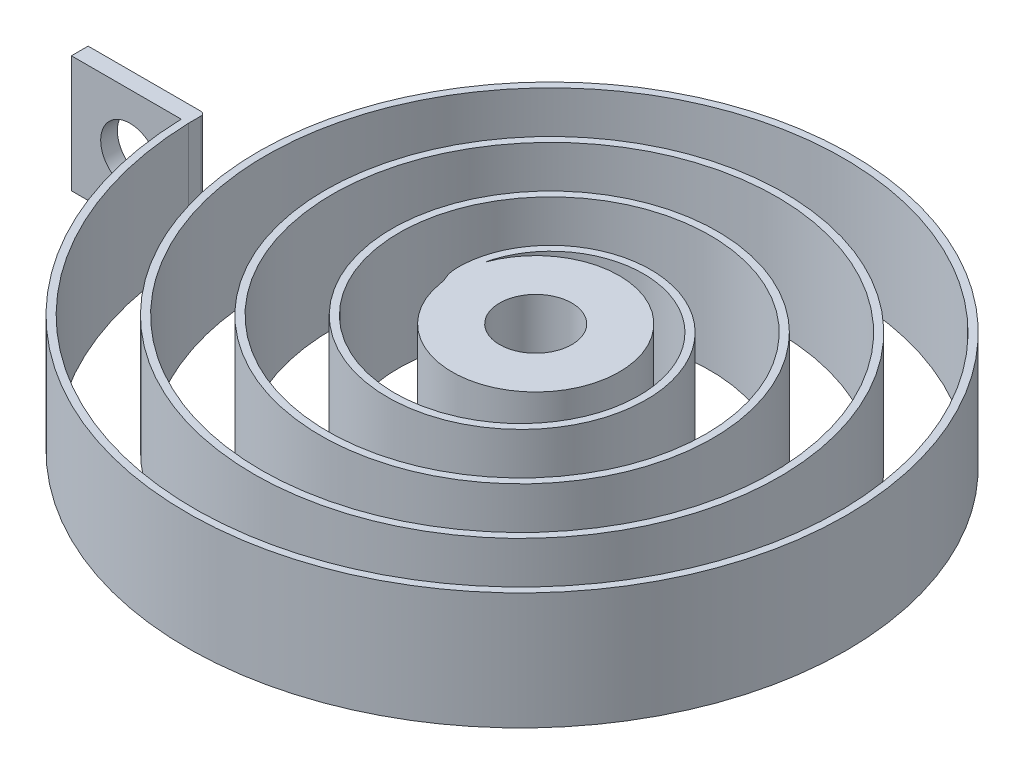
from build123d import *

# Parameters (mm, degrees)
SWEEP1_START                    = -3.5
SWEEP1_DEPTH                    = 7
BOSS_EXTRUDE1_REACH             = 31.519
SKETCH1_2_R                     = 5
BOSS_EXTRUDE1_DIRECTION_2_REACH = 31.519
FILLET3_START                   = -3.5
FILLET3_DEPTH                   = 7
FILLET4_R                       = 2
SKETCH4_R                       = 2.16
CUT_EXTRUDE1_DEPTH              = 10
SKETCH5_W                       = 7
SKETCH5_H                       = 7
SKETCH5_R                       = 1.75
BOSS_EXTRUDE2_DEPTH             = 1
FILLET5_R                       = 0.25


with BuildPart() as part:
    # Sweep1: read off the stored shape, not the designer's step
    # Sweep1 outline → Sweep1 (new body)
    with BuildSketch(Plane(origin=(0, 0, 0), x_dir=(1, 0, 0), z_dir=(0, 1, 0)).offset(SWEEP1_START)):
        with BuildLine():
            Line((-20.785, 0), (-21.215, 0))
            add(Edge.make_bspline(
                [(-21.215, 0), (-21.173333333, -1.388634337), (-20.994930467, -2.768733576), (-20.374561584, -5.460332365), (-19.932724038, -6.771240086), (-18.805422102, -9.274972201), (-18.120199272, -10.467240822), (-16.535185434, -12.689328435), (-15.635739642, -13.718649838), (-13.659235469, -15.577242594), (-12.582612544, -16.406093616), (-10.295091101, -17.834277946), (-9.08470141, -18.433284253), (-6.577621153, -19.38148147), (-5.281493114, -19.730451177), (-2.653646771, -20.168118886), (-1.322522982, -20.256709861), (1.32385302, -20.17328911), (2.638501649, -20.001288507), (5.201704096, -19.406369), (6.449668499, -18.983578792), (8.832435955, -17.906285055), (9.966686424, -17.252022693), (12.079889241, -15.739654206), (13.058347055, -14.881892298), (14.82431886, -12.997879107), (15.611415327, -11.972061714), (16.966801562, -9.793322785), (17.534766786, -8.640908002), (18.43278605, -6.254721691), (18.7626209, -5.021510184), (19.174658872, -2.522023744), (19.256756463, -1.25634048), (19.173238974, 1.259142005), (19.007635941, 2.508340721), (18.43815635, 4.943145714), (18.034408803, 6.128165774), (17.007114026, 8.389965579), (16.383807661, 9.466195942), (14.94407588, 11.470509136), (14.127993772, 12.39810052), (12.336463874, 14.071444831), (11.361448493, 14.81678309), (9.291485689, 16.099363157), (8.197043019, 16.636282943), (5.931745866, 17.484114908), (4.761448959, 17.794809991), (2.390319487, 18.181207924), (1.190075791, 18.256806833), (-1.194514066, 18.173181714), (-2.378262776, 18.01397076), (-4.684669039, 17.469920006), (-5.806743571, 17.085209645), (-7.947572247, 16.107902993), (-8.965780228, 15.515547378), (-10.861198165, 14.148442146), (-11.737919798, 13.37403504), (-13.318628953, 11.674979388), (-14.022204723, 10.750761872), (-15.231969153, 8.789567656), (-15.737838391, 7.753093798), (-16.535472074, 5.608680137), (-16.827021615, 4.501295541), (-17.187767382, 2.258519547), (-17.256861369, 1.123714273), (-17.173115776, -1.129984041), (-17.020290421, -2.24828265), (-16.50165542, -4.426288716), (-16.135975771, -5.485416335), (-15.208644423, -7.505269809), (-14.647233346, -8.465452734), (-13.352742626, -10.251968779), (-12.620004824, -11.077816744), (-11.013412671, -12.565881697), (-10.139988091, -13.22768992), (-8.287553487, -14.364627504), (-7.309164801, -14.839391754), (-4.273498509, -15.960670475), (-2.119176002, -16.298866325), (2.127508926, -16.131093303), (4.214273814, -15.625595419), (8.013004015, -13.870433491), (9.719727446, -12.623341728), (12.511295005, -9.594294416), (13.592300411, -7.816705559), (14.987088983, -4.010376207), (15.299009008, -1.987116954), (15.130924741, 1.997791579), (14.65129974, 3.953688928), (12.996017692, 7.510447085), (11.822905549, 9.106163281), (8.978725369, 11.712393164), (7.311961894, 12.719147717), (3.74734768, 14.013441924), (1.854890623, 14.299168535), (-1.86824592, 14.130727758), (-3.69327339, 13.676952896), (-7.0080456, 12.121504905), (-8.492743135, 11.022351179), (-10.91360337, 8.362999085), (-11.846087403, 6.807044925), (-13.039840351, 3.484120646), (-13.299347895, 1.722458035), (-13.130494684, -1.738912223), (-12.702541786, -3.433067039), (-11.246870909, -6.505836323), (-10.22164918, -7.879501119), (-7.747076329, -10.114952113), (-6.30191132, -10.97314118), (-3.220645148, -12.066294366), (-1.589767111, -12.29955074), (1.609844402, -12.130214869), (3.173123255, -11.728048456), (6.003868581, -10.372082713), (7.266483012, -9.420759482), (9.31647492, -7.130903662), (10.100338103, -5.796502014), (11.092817231, -2.956852955), (11.299781523, -1.456746658), (11.129873128, 1.481116319), (10.753447645, 2.913515228), (9.497094207, 5.502210113), (8.619626116, 6.653751705), (6.514406374, 8.518220543), (5.290734375, 9.227717945), (2.6926484, 10.119426665), (1.323296738, 10.300045598), (-1.352831914, 10.129447086), (-2.654346069, 9.778702687), (-5.000956523, 8.621838953), (-6.041395993, 7.818168496), (-7.720257713, 5.897476779), (-8.355336597, 4.784489181), (-9.146146785, 2.427893073), (-9.300349167, 1.189272571), (-9.128902466, -1.225142215), (-8.803758328, -2.395765787), (-7.746217655, -4.500247189), (-7.016266272, -5.429545378), (-5.279953823, -6.922686458), (-4.277587926, -7.483275058), (-2.162379045, -8.173011058), (-1.054456305, -8.30069871), (1.098275298, -8.128184225), (2.138001258, -7.828527432), (4.000293422, -6.870075134), (4.818396272, -6.213731508), (6.125658006, -4.661585518), (6.611655078, -3.769750909), (7.200066733, -1.895779154), (7.301098828, -0.91850447), (7.127198617, 0.972592331), (6.852864545, 1.881412415), (5.993154951, 3.501431392), (5.410253873, 4.208261237), (4.041954653, 5.329411849), (3.260514165, 5.74066784), (1.627547817, 6.227381076), (0.780842827, 6.301545133), (-0.848700492, 6.125773558), (-1.626605724, 5.876508539), (-3.00422934, 5.115001808), (-3.599668637, 4.605282762), (-4.534349538, 3.420318148), (-4.870629729, 2.749049262), (-5.255047538, 1.356704017), (-5.302006722, 0.640495151), (-5.212780426, -0.043633785)],
                knots=[0, 0, 0, 0, 0.0078125, 0.0078125, 0.015625, 0.015625, 0.0234375, 0.0234375, 0.03125, 0.03125, 0.0390625, 0.0390625, 0.046875, 0.046875, 0.0546875, 0.0546875, 0.0625, 0.0625, 0.0703125, 0.0703125, 0.078125, 0.078125, 0.0859375, 0.0859375, 0.09375, 0.09375, 0.1015625, 0.1015625, 0.109375, 0.109375, 0.1171875, 0.1171875, 0.125, 0.125, 0.1328125, 0.1328125, 0.140625, 0.140625, 0.1484375, 0.1484375, 0.15625, 0.15625, 0.1640625, 0.1640625, 0.171875, 0.171875, 0.1796875, 0.1796875, 0.1875, 0.1875, 0.1953125, 0.1953125, 0.203125, 0.203125, 0.2109375, 0.2109375, 0.21875, 0.21875, 0.2265625, 0.2265625, 0.234375, 0.234375, 0.2421875, 0.2421875, 0.25, 0.25, 0.2578125, 0.2578125, 0.265625, 0.265625, 0.2734375, 0.2734375, 0.28125, 0.28125, 0.2890625, 0.2890625, 0.296875, 0.296875, 0.3125, 0.3125, 0.328125, 0.328125, 0.34375, 0.34375, 0.359375, 0.359375, 0.375, 0.375, 0.390625, 0.390625, 0.40625, 0.40625, 0.421875, 0.421875, 0.4375, 0.4375, 0.453125, 0.453125, 0.46875, 0.46875, 0.484375, 0.484375, 0.5, 0.5, 0.515625, 0.515625, 0.53125, 0.53125, 0.546875, 0.546875, 0.5625, 0.5625, 0.578125, 0.578125, 0.59375, 0.59375, 0.609375, 0.609375, 0.625, 0.625, 0.640625, 0.640625, 0.65625, 0.65625, 0.671875, 0.671875, 0.6875, 0.6875, 0.703125, 0.703125, 0.71875, 0.71875, 0.734375, 0.734375, 0.75, 0.75, 0.765625, 0.765625, 0.78125, 0.78125, 0.796875, 0.796875, 0.8125, 0.8125, 0.828125, 0.828125, 0.84375, 0.84375, 0.859375, 0.859375, 0.875, 0.875, 0.890625, 0.890625, 0.90625, 0.90625, 0.921875, 0.921875, 0.9375, 0.9375, 0.953125, 0.953125, 0.96875, 0.96875, 0.984375, 0.984375, 1, 1, 1, 1], degree=3))
            Line((-5.212780426, -0.043633785), (-4.785, 0))
            add(Edge.make_bspline(
                [(-20.785, 0), (-20.743333333, -1.36037507), (-20.567689875, -2.712483012), (-19.958357911, -5.348649094), (-19.524692534, -6.632643695), (-18.419039867, -9.084164872), (-17.747087497, -10.251634026), (-16.193502077, -12.426742886), (-15.311914253, -13.434333423), (-13.37540786, -15.252988689), (-12.320542956, -16.064014303), (-10.080048839, -17.460840465), (-8.894479554, -18.046613345), (-6.439645581, -18.973239523), (-5.170444694, -19.314077529), (-2.598051929, -19.740792337), (-1.294925213, -19.826666665), (1.294925213, -19.743333335), (2.581584937, -19.574135963), (5.089366525, -18.990341263), (6.310428037, -18.575766429), (8.641013666, -17.520206906), (9.750483352, -16.879255898), (11.816753094, -15.398394451), (12.773506673, -14.558527441), (14.499601878, -12.71458111), (15.268906677, -11.710553164), (16.593008866, -9.578898165), (17.147780384, -8.451328348), (18.024313418, -6.117429923), (18.34606088, -4.911162125), (18.747238425, -2.467153854), (18.826666665, -1.229475366), (18.743333335, 1.229475366), (18.58058205, 2.450686861), (18.022324614, 4.830083957), (17.626840324, 5.988212378), (16.621373946, 8.197862459), (16.011424299, 9.249332677), (14.603286826, 11.206763302), (13.805140629, 12.112679922), (12.053754359, 13.746215066), (11.100563372, 14.473799051), (9.077747491, 15.725177267), (8.008177141, 16.248947424), (5.795214264, 17.075387314), (4.651879556, 17.378044232), (2.336255778, 17.753684513), (1.164025519, 17.826666665), (-1.164025519, 17.743333335), (-2.319788786, 17.587028138), (-4.570801388, 17.054307966), (-5.66599672, 16.67791422), (-7.754711253, 15.722540986), (-8.748182003, 15.1435927), (-10.596773511, 13.8081792), (-11.451853171, 13.051753817), (-12.992828254, 11.392927609), (-13.678691426, 10.49057358), (-14.857345668, 8.576596817), (-15.350114463, 7.565025935), (-16.126461209, 5.472998606), (-16.410027583, 4.392596988), (-16.7601306, 2.205357703), (-16.826666665, 1.098575672), (-16.743333335, -1.098575672), (-16.593474226, -2.18889071), (-16.086291317, -4.31151882), (-15.728988115, -5.343781062), (-14.823708025, -7.311560047), (-14.275761101, -8.247031329), (-13.013071575, -9.986783719), (-12.298367005, -10.791026421), (-10.732100858, -12.239441442), (-9.880583788, -12.8835838), (-8.075446143, -13.98951407), (-7.121874736, -14.451281661), (-4.165237041, -15.54066159), (-2.066251536, -15.868333307), (2.066251536, -15.701666693), (4.098143782, -15.207655418), (7.791830462, -13.497281658), (9.452272254, -12.281833138), (12.163982047, -9.334421163), (13.214368335, -7.603801523), (14.566689208, -3.903489288), (14.868333305, -1.935351842), (14.701666695, 1.935351842), (14.233682739, 3.836395897), (12.623495271, 7.288211482), (11.482166294, 8.837725533), (8.719874444, 11.364315206), (7.100182542, 12.340581945), (3.641741405, 13.592716533), (1.804452148, 13.868333303), (-1.804452148, 13.701666697), (-3.574648011, 13.25971006), (-6.784592503, 11.749708885), (-8.223178811, 10.68249945), (-10.564648365, 8.105327726), (-11.466795554, 6.59656356), (-12.618743858, 3.379993521), (-12.868333301, 1.673552454), (-12.701666699, -1.673552454), (-12.285737381, -3.312900126), (-10.875922499, -6.280973523), (-9.882832606, -7.60863209), (-7.490781008, -9.764981524), (-6.092944579, -10.593009164), (-3.118245638, -11.644771184), (-1.54265276, -11.868333298), (1.54265276, -11.701666702), (3.051152241, -11.311764702), (5.777354544, -10.002136113), (6.994085368, -9.083165761), (8.965314684, -6.87623429), (9.719222772, -5.589325597), (10.67079851, -2.856497755), (10.868333294, -1.411753066), (10.701666706, 1.411753066), (10.337792022, 2.789404355), (9.128349728, 5.273735565), (8.283498916, 6.379538645), (6.261687573, 8.165647844), (5.085706615, 8.84543638), (2.594749872, 9.696825837), (1.280853372, 9.86833329), (-1.280853372, 9.70166671), (-2.52765647, 9.363819342), (-4.770116586, 8.254563343), (-5.764991922, 7.483832071), (-7.365981004, 5.647140856), (-7.971649988, 4.582087633), (-8.722853165, 2.33300199), (-8.868333286, 1.149953678), (-8.701666714, -1.149953678), (-8.38984666, -2.265908583), (-7.38077696, -4.266497607), (-6.684165224, -5.150445199), (-5.03259414, -6.566314166), (-4.07846865, -7.097863594), (-2.071254108, -7.748880493), (-1.019053984, -7.868333279), (1.019053984, -7.701666721), (2.004160697, -7.415873977), (3.762878629, -6.506990578), (4.535898474, -5.884498377), (5.766647328, -4.418047425), (6.224077199, -3.574849667), (6.774907823, -1.809506227), (6.868333271, -0.888154289), (6.701666729, 0.888154289), (6.441901292, 1.742412809), (5.633204197, 3.259259652), (5.084831528, 3.921351747), (3.803500712, 4.966980492), (3.071230682, 5.350290802), (1.547758346, 5.800935156), (0.757254595, 5.868333261), (-0.757254595, 5.701666739), (-1.480664921, 5.467928605), (-2.755640676, 4.75941782), (-3.306805019, 4.285164676), (-4.167313658, 3.188954001), (-4.476504401, 2.567611696), (-4.826962492, 1.286010468), (-4.868333335, 0.626355045), (-4.785, 0)],
                knots=[0, 0, 0, 0, 0.0078125, 0.0078125, 0.015625, 0.015625, 0.0234375, 0.0234375, 0.03125, 0.03125, 0.0390625, 0.0390625, 0.046875, 0.046875, 0.0546875, 0.0546875, 0.0625, 0.0625, 0.0703125, 0.0703125, 0.078125, 0.078125, 0.0859375, 0.0859375, 0.09375, 0.09375, 0.1015625, 0.1015625, 0.109375, 0.109375, 0.1171875, 0.1171875, 0.125, 0.125, 0.1328125, 0.1328125, 0.140625, 0.140625, 0.1484375, 0.1484375, 0.15625, 0.15625, 0.1640625, 0.1640625, 0.171875, 0.171875, 0.1796875, 0.1796875, 0.1875, 0.1875, 0.1953125, 0.1953125, 0.203125, 0.203125, 0.2109375, 0.2109375, 0.21875, 0.21875, 0.2265625, 0.2265625, 0.234375, 0.234375, 0.2421875, 0.2421875, 0.25, 0.25, 0.2578125, 0.2578125, 0.265625, 0.265625, 0.2734375, 0.2734375, 0.28125, 0.28125, 0.2890625, 0.2890625, 0.296875, 0.296875, 0.3125, 0.3125, 0.328125, 0.328125, 0.34375, 0.34375, 0.359375, 0.359375, 0.375, 0.375, 0.390625, 0.390625, 0.40625, 0.40625, 0.421875, 0.421875, 0.4375, 0.4375, 0.453125, 0.453125, 0.46875, 0.46875, 0.484375, 0.484375, 0.5, 0.5, 0.515625, 0.515625, 0.53125, 0.53125, 0.546875, 0.546875, 0.5625, 0.5625, 0.578125, 0.578125, 0.59375, 0.59375, 0.609375, 0.609375, 0.625, 0.625, 0.640625, 0.640625, 0.65625, 0.65625, 0.671875, 0.671875, 0.6875, 0.6875, 0.703125, 0.703125, 0.71875, 0.71875, 0.734375, 0.734375, 0.75, 0.75, 0.765625, 0.765625, 0.78125, 0.78125, 0.796875, 0.796875, 0.8125, 0.8125, 0.828125, 0.828125, 0.84375, 0.84375, 0.859375, 0.859375, 0.875, 0.875, 0.890625, 0.890625, 0.90625, 0.90625, 0.921875, 0.921875, 0.9375, 0.9375, 0.953125, 0.953125, 0.96875, 0.96875, 0.984375, 0.984375, 1, 1, 1, 1], degree=3))
        make_face()
    extrude(amount=SWEEP1_DEPTH)

    # Boss-Extrude1: up to this face of the body (flat: up to its plane)
    boss_extrude1_end = Plane(part.part.faces().sort_by_distance((-21, 3.5, 0.558026118))[0])
    # Sketch1<2> → Boss-Extrude1 (add, up to the picked face)
    with BuildSketch(Plane(origin=(0, 0, 0), x_dir=(1, 0, 0), z_dir=(0, 1, 0)), mode=Mode.PRIVATE) as boss_extrude1_sk1:
        Circle(SKETCH1_2_R)
    boss_extrude1_tool1 = split(extrude(boss_extrude1_sk1.sketch, amount=BOSS_EXTRUDE1_REACH, mode=Mode.PRIVATE), bisect_by=boss_extrude1_end, keep=Keep.BOTH, mode=Mode.PRIVATE)
    add(boss_extrude1_tool1.solids().sort_by(Axis((0, 0, 0), (0, 1, 0)))[0])

    # Boss-Extrude1 direction 2: up to this face of the body (flat: up to its plane)
    boss_extrude1_direction_2_end = Plane(part.part.faces().sort_by_distance((-21, -3.5, 0.558026118))[0])
    # Sketch1<2> → Boss-Extrude1 direction 2 (add, up to the picked face)
    with BuildSketch(Plane(origin=(0, 0, 0), x_dir=(1, 0, 0), z_dir=(0, 1, 0)), mode=Mode.PRIVATE) as boss_extrude1_direction_2_sk1:
        Circle(SKETCH1_2_R)
    boss_extrude1_direction_2_tool1 = split(extrude(boss_extrude1_direction_2_sk1.sketch, amount=-BOSS_EXTRUDE1_DIRECTION_2_REACH, mode=Mode.PRIVATE), bisect_by=boss_extrude1_direction_2_end, keep=Keep.BOTH, mode=Mode.PRIVATE)
    add(boss_extrude1_direction_2_tool1.solids().sort_by(Axis((0, 0, 0), (0, -1, 0)))[0])

    # Fillet3: read off the stored shape, not the designer's step
    # Fillet3 outline → Fillet3 (add)
    with BuildSketch(Plane(origin=(0, 0, 0), x_dir=(1, 0, 0), z_dir=(0, 1, 0)).offset(FILLET3_START)):
        with BuildLine():
            ThreePointArc((-5.212780426, -0.043633785), (-5.038804044, -0.399480223), (-4.938368486, -0.782634458))
            ThreePointArc((-4.938368486, -0.782634458), (-4.983695698, -0.403456548), (-4.999951928, -0.021925188))
            Line((-4.999951928, -0.021925188), (-5.212780426, -0.043633785))
        make_face()
    extrude(amount=FILLET3_DEPTH)

    # Fillet4
    fillet4_edges = [part.edges().sort_by_distance(p)[0] for p in [
        (-5.212780426, 0, 0.043633785),
    ]]
    fillet(fillet4_edges, radius=FILLET4_R)

    # Sketch4 → Cut-Extrude1 (cut)
    with BuildSketch(Plane(origin=(0, 3.5, 0), x_dir=(1, 0, 0), z_dir=(0, 1, 0))):
        with Locations(Location((0, 0, 0), (0, 0, 270))):
            Circle(SKETCH4_R)
    extrude(amount=-CUT_EXTRUDE1_DEPTH, mode=Mode.SUBTRACT)

    # Sketch5 → Boss-Extrude2 (add)
    with BuildSketch(Plane(origin=(0, 0, 0), x_dir=(-1, 0, 0), z_dir=(0, 0, -1))):
        with Locations((24.285, 0)):
            Rectangle(SKETCH5_W, SKETCH5_H)
        with Locations((24.285, 0)):
            Circle(SKETCH5_R, mode=Mode.SUBTRACT)
    extrude(amount=BOSS_EXTRUDE2_DEPTH)

    # Fillet5
    fillet5_edges = [part.edges().sort_by_distance(p)[0] for p in [
        (-20.785, 0, -1),
    ]]
    fillet(fillet5_edges, radius=FILLET5_R)


solid = part.part
